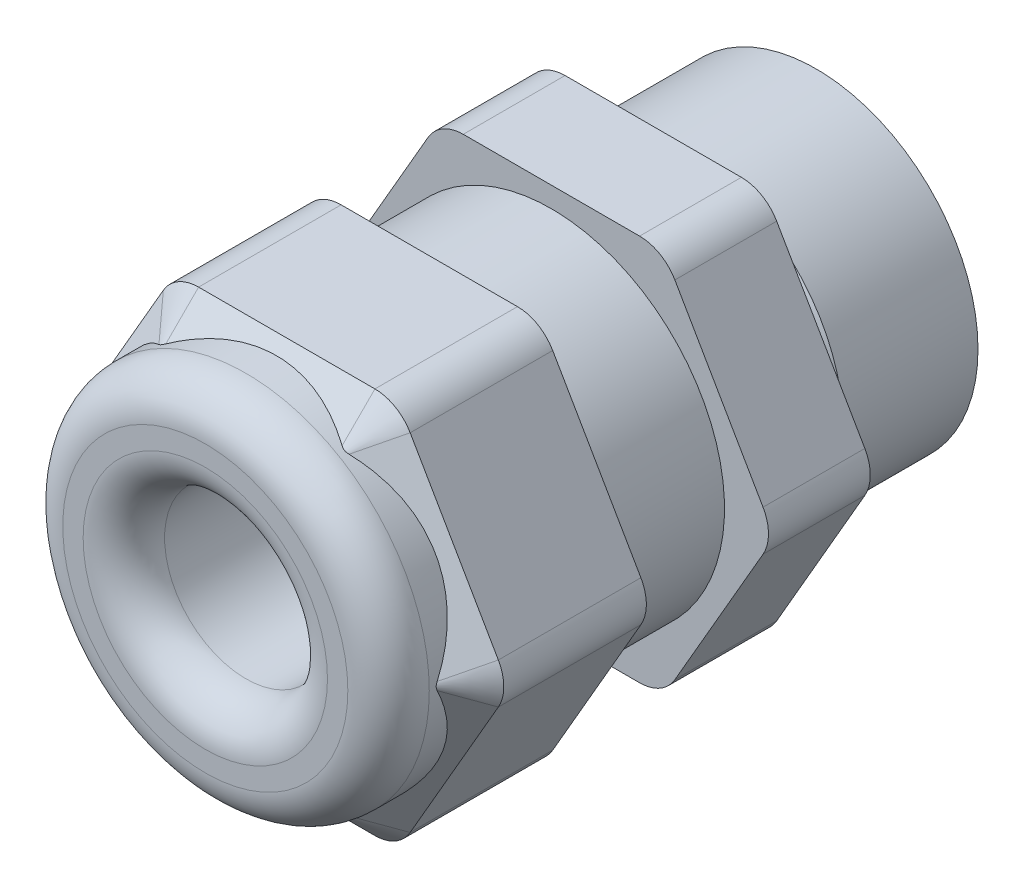
from build123d import *
from OCP.BRepFilletAPI import BRepFilletAPI_MakeChamfer

# Parameters (mm, degrees)
BOSS_EXTRUDE1_DEPTH = 22
SKETCH2_R           = 7.95
BOSS_EXTRUDE2_DEPTH = 8
SKETCH3_OUTSIDE_W   = 32.288
SKETCH3_OUTSIDE_H   = 29.348
SKETCH3_OUTSIDE_R   = 9
CUT_EXTRUDE1_DEPTH  = 2
FILLET1_R           = 2
CHAMFER1_SIZE       = 2
FILLET2_R           = 2
CUT_EXTRUDE2_START  = -5
SKETCH4_OUTSIDE_W   = 31.604
SKETCH4_OUTSIDE_H   = 29.284
SKETCH4_OUTSIDE_R   = 8.5
CUT_EXTRUDE2_DEPTH  = 6
SKETCH5_R           = 4
CUT_EXTRUDE3_DEPTH  = 3
FILLET3_R           = 2
SKETCH6_R           = 5
CUT_EXTRUDE4_DEPTH  = 19
SKETCH7_R           = 0.7
CUT_EXTRUDE5_DEPTH  = 31.543264727
CHAMFER2_SIZE       = 0.5
CHAMFER2_SIZE2      = 0.288675135
SKETCH9_R           = 4
CUT_EXTRUDE6_DEPTH  = 31.543264727


with BuildPart() as part:
    # Sketch1 → Boss-Extrude1 (new body)
    with BuildSketch(Plane.XY):
        Polygon((10.969655115, 0), (5.484827557, 9.5), (-5.484827557, 9.5), (-10.969655115, 0), (-5.484827557, -9.5), (5.484827557, -9.5), align=None)
    extrude(amount=BOSS_EXTRUDE1_DEPTH)

    # Sketch2 → Boss-Extrude2 (add)
    with BuildSketch(Plane(origin=(0, 0, 0), x_dir=(-1, 0, 0), z_dir=(0, 0, -1))):
        Circle(SKETCH2_R)
    extrude(amount=BOSS_EXTRUDE2_DEPTH)

    # Sketch3 outside → Cut-Extrude1 (cut)
    with BuildSketch(Plane.XY.offset(22)):
        Rectangle(SKETCH3_OUTSIDE_W, SKETCH3_OUTSIDE_H)
        Circle(SKETCH3_OUTSIDE_R, mode=Mode.SUBTRACT)
    extrude(amount=-CUT_EXTRUDE1_DEPTH, mode=Mode.SUBTRACT)

    # Fillet1
    fillet1_edges = [part.edges().sort_by_distance(p)[0] for p in [
        (5.484827557, -9.5, 10),
        (-5.484827557, -9.5, 10),
        (-10.969655115, 0, 10),
        (-5.484827557, 9.5, 10),
        (5.484827557, 9.5, 10),
        (10.969655115, 0, 10),
    ]]
    fillet(fillet1_edges, radius=FILLET1_R)

    # Chamfer1
    # the kernel refuses this chamfer: 2 mm, written as the material it takes off along each edge
    with BuildSketch(Plane(origin=(-4.330127019, -9.5, 20), x_dir=(0, 1, 0), z_dir=(1, 0, 0))) as chamfer1_piece_1_section:
        Polygon((CHAMFER1_SIZE, 0), (0, -CHAMFER1_SIZE), (0, 0), align=None)
    chamfer1_piece_1 = extrude(amount=8.660254038, mode=Mode.PRIVATE)
    chamfer1_piece_1 = chamfer1_piece_1 - Plane(origin=(0, 0, 20), x_dir=(1, 0, 0), z_dir=(0, 0, 1)) * Cylinder(9, 26, mode=Mode.PRIVATE)
    add(chamfer1_piece_1, mode=Mode.SUBTRACT)
    with BuildSketch(Plane(origin=(4.330127019, -7.5, 20), x_dir=(0.8660254037844417, -0.49999999999999456, 0), z_dir=(0.49999999999999456, 0.8660254037844417, 0))) as chamfer1_piece_2_section:
        Polygon((2 - CHAMFER1_SIZE, 0), (2, CHAMFER1_SIZE), (2, 0), align=None)
    chamfer1_piece_2 = revolve(axis=Axis((4.330127019, -7.5, 20), (0, 0, -1)), revolution_arc=60, mode=Mode.PRIVATE)
    chamfer1_piece_2 = chamfer1_piece_2 - Plane(origin=(0, 0, 20), x_dir=(1, 0, 0), z_dir=(0, 0, 1)) * Cylinder(9, 8, mode=Mode.PRIVATE)
    add(chamfer1_piece_2, mode=Mode.SUBTRACT)
    with BuildSketch(Plane(origin=(-4.330127019, -7.5, 20), x_dir=(0, -1, 0), z_dir=(1, 0, 0))) as chamfer1_piece_3_section:
        Polygon((2 - CHAMFER1_SIZE, 0), (2, CHAMFER1_SIZE), (2, 0), align=None)
    chamfer1_piece_3 = revolve(axis=Axis((-4.330127019, -7.5, 20), (0, 0, -1)), revolution_arc=60, mode=Mode.PRIVATE)
    chamfer1_piece_3 = chamfer1_piece_3 - Plane(origin=(0, 0, 20), x_dir=(1, 0, 0), z_dir=(0, 0, 1)) * Cylinder(9, 8, mode=Mode.PRIVATE)
    add(chamfer1_piece_3, mode=Mode.SUBTRACT)
    with BuildSketch(Plane(origin=(6.062177826, -8.5, 20), x_dir=(-0.8660254037844416, 0.499999999999995, 0), z_dir=(0.499999999999995, 0.8660254037844416, 0))) as chamfer1_piece_4_section:
        Polygon((CHAMFER1_SIZE, 0), (0, -CHAMFER1_SIZE), (0, 0), align=None)
    chamfer1_piece_4 = extrude(amount=8.660254038, mode=Mode.PRIVATE)
    chamfer1_piece_4 = chamfer1_piece_4 - Plane(origin=(0, 0, 20), x_dir=(1, 0, 0), z_dir=(0, 0, 1)) * Cylinder(9, 26, mode=Mode.PRIVATE)
    add(chamfer1_piece_4, mode=Mode.SUBTRACT)
    with BuildSketch(Plane(origin=(-10.392304845, -1, 20), x_dir=(0.8660254037844345, 0.5000000000000072, 0), z_dir=(0.5000000000000072, -0.8660254037844346, 0))) as chamfer1_piece_5_section:
        Polygon((CHAMFER1_SIZE, 0), (0, -CHAMFER1_SIZE), (0, 0), align=None)
    chamfer1_piece_5 = extrude(amount=8.660254038, mode=Mode.PRIVATE)
    chamfer1_piece_5 = chamfer1_piece_5 - Plane(origin=(0, 0, 20), x_dir=(1, 0, 0), z_dir=(0, 0, 1)) * Cylinder(9, 26, mode=Mode.PRIVATE)
    add(chamfer1_piece_5, mode=Mode.SUBTRACT)
    with BuildSketch(Plane(origin=(8.660254038, 0, 20), x_dir=(0.866025403784438, 0.500000000000001, 0), z_dir=(-0.500000000000001, 0.866025403784438, 0))) as chamfer1_piece_6_section:
        Polygon((2, CHAMFER1_SIZE), (2 - CHAMFER1_SIZE, 0), (2, 0), align=None)
    chamfer1_piece_6 = revolve(axis=Axis((8.660254038, 0, 20), (0, 0, -1)), revolution_arc=60, mode=Mode.PRIVATE)
    chamfer1_piece_6 = chamfer1_piece_6 - Plane(origin=(0, 0, 20), x_dir=(1, 0, 0), z_dir=(0, 0, 1)) * Cylinder(9, 9, mode=Mode.PRIVATE)
    add(chamfer1_piece_6, mode=Mode.SUBTRACT)
    with BuildSketch(Plane(origin=(-8.660254038, 0, 20), x_dir=(-0.8660254037844414, 0.4999999999999952, 0), z_dir=(0.4999999999999952, 0.8660254037844414, 0))) as chamfer1_piece_7_section:
        Polygon((2 - CHAMFER1_SIZE, 0), (2, -CHAMFER1_SIZE), (2, 0), align=None)
    chamfer1_piece_7 = revolve(axis=Axis((-8.660254038, 0, 20), (0, 0, 1)), revolution_arc=60, mode=Mode.PRIVATE)
    chamfer1_piece_7 = chamfer1_piece_7 - Plane(origin=(0, 0, 20), x_dir=(1, 0, 0), z_dir=(0, 0, 1)) * Cylinder(9, 8, mode=Mode.PRIVATE)
    add(chamfer1_piece_7, mode=Mode.SUBTRACT)
    with BuildSketch(Plane(origin=(10.392304845, 1, 20), x_dir=(0, 0, -1), z_dir=(-0.500000000000001, 0.866025403784438, 0))) as chamfer1_piece_8_section:
        Polygon((CHAMFER1_SIZE, 0), (0, CHAMFER1_SIZE), (0, 0), align=None)
    chamfer1_piece_8 = extrude(amount=8.660254038, mode=Mode.PRIVATE)
    chamfer1_piece_8 = chamfer1_piece_8 - Plane(origin=(0, 0, 20), x_dir=(1, 0, 0), z_dir=(0, 0, 1)) * Cylinder(9, 26, mode=Mode.PRIVATE)
    add(chamfer1_piece_8, mode=Mode.SUBTRACT)
    with BuildSketch(Plane(origin=(-6.062177826, 8.5, 20), x_dir=(0.8660254037844415, -0.49999999999999517, 0), z_dir=(-0.49999999999999517, -0.8660254037844415, 0))) as chamfer1_piece_9_section:
        Polygon((CHAMFER1_SIZE, 0), (0, -CHAMFER1_SIZE), (0, 0), align=None)
    chamfer1_piece_9 = extrude(amount=8.660254038, mode=Mode.PRIVATE)
    chamfer1_piece_9 = chamfer1_piece_9 - Plane(origin=(0, 0, 20), x_dir=(1, 0, 0), z_dir=(0, 0, 1)) * Cylinder(9, 26, mode=Mode.PRIVATE)
    add(chamfer1_piece_9, mode=Mode.SUBTRACT)
    with BuildSketch(Plane(origin=(4.330127019, 7.5, 20), x_dir=(0.8660254037844379, 0.5000000000000013, 0), z_dir=(0.5000000000000013, -0.8660254037844379, 0))) as chamfer1_piece_10_section:
        Polygon((2, -CHAMFER1_SIZE), (2 - CHAMFER1_SIZE, 0), (2, 0), align=None)
    chamfer1_piece_10 = revolve(axis=Axis((4.330127019, 7.5, 20), (0, 0, 1)), revolution_arc=60, mode=Mode.PRIVATE)
    chamfer1_piece_10 = chamfer1_piece_10 - Plane(origin=(0, 0, 20), x_dir=(1, 0, 0), z_dir=(0, 0, 1)) * Cylinder(9, 9, mode=Mode.PRIVATE)
    add(chamfer1_piece_10, mode=Mode.SUBTRACT)
    with BuildSketch(Plane(origin=(-4.330127019, 7.5, 20), x_dir=(0, 1, 0), z_dir=(1, 0, 0))) as chamfer1_piece_11_section:
        Polygon((2 - CHAMFER1_SIZE, 0), (2, -CHAMFER1_SIZE), (2, 0), align=None)
    chamfer1_piece_11 = revolve(axis=Axis((-4.330127019, 7.5, 20), (0, 0, 1)), revolution_arc=60, mode=Mode.PRIVATE)
    chamfer1_piece_11 = chamfer1_piece_11 - Plane(origin=(0, 0, 20), x_dir=(1, 0, 0), z_dir=(0, 0, 1)) * Cylinder(9, 8, mode=Mode.PRIVATE)
    add(chamfer1_piece_11, mode=Mode.SUBTRACT)
    with BuildSketch(Plane(origin=(4.330127019, 9.5, 20), x_dir=(0, -1, 0), z_dir=(-1, 0, 0))) as chamfer1_piece_12_section:
        Polygon((CHAMFER1_SIZE, 0), (0, -CHAMFER1_SIZE), (0, 0), align=None)
    chamfer1_piece_12 = extrude(amount=8.660254038, mode=Mode.PRIVATE)
    chamfer1_piece_12 = chamfer1_piece_12 - Plane(origin=(0, 0, 20), x_dir=(1, 0, 0), z_dir=(0, 0, 1)) * Cylinder(9, 26, mode=Mode.PRIVATE)
    add(chamfer1_piece_12, mode=Mode.SUBTRACT)

    # Fillet2
    # the kernel refuses this fillet: 2 mm, written as the material it takes off along each edge
    with BuildSketch(Plane(origin=(0, 0, 22), x_dir=(1, 0, 0), z_dir=(0, -1, 0))) as fillet2_piece_1:
        with BuildLine():
            CenterArc((9 - FILLET2_R, -FILLET2_R), FILLET2_R, 0, 90)
            Line((9 - FILLET2_R, 0), (9, 0))
            Line((9, 0), (9, -FILLET2_R))
        make_face()
    revolve(axis=Axis((0, 0, 22), (0, 0, 1)), mode=Mode.SUBTRACT)

    # Sketch4 outside → Cut-Extrude2 (cut)
    with BuildSketch(Plane(origin=(0, 0, 0), x_dir=(-1, 0, 0), z_dir=(0, 0, -1)).offset(CUT_EXTRUDE2_START)):
        Rectangle(SKETCH4_OUTSIDE_W, SKETCH4_OUTSIDE_H)
        Circle(SKETCH4_OUTSIDE_R, mode=Mode.SUBTRACT)
    extrude(amount=-CUT_EXTRUDE2_DEPTH, mode=Mode.SUBTRACT)

    # Sketch5 → Cut-Extrude3 (cut)
    with BuildSketch(Plane.XY.offset(22)):
        Circle(SKETCH5_R)
    extrude(amount=-CUT_EXTRUDE3_DEPTH, mode=Mode.SUBTRACT)

    # Fillet3
    fillet3_edges = [part.edges().sort_by_distance(p)[0] for p in [
        (-4, 0, 22),
    ]]
    fillet(fillet3_edges, radius=FILLET3_R)

    # Sketch6 → Cut-Extrude4 (cut)
    with BuildSketch(Plane(origin=(0, 0, -8), x_dir=(-1, 0, 0), z_dir=(0, 0, -1))):
        Circle(SKETCH6_R)
    extrude(amount=-CUT_EXTRUDE4_DEPTH, mode=Mode.SUBTRACT)

    # Sketch7 → Cut-Extrude5 (cut, through all)
    with BuildSketch(Plane.XY.offset(19)):
        with Locations((-2.5, 0)):
            Circle(SKETCH7_R)
        with Locations((-1.25, 2.165063509)):
            Circle(SKETCH7_R)
        with Locations((1.25, 2.165063509)):
            Circle(SKETCH7_R)
        with Locations((2.5, 0)):
            Circle(SKETCH7_R)
        with Locations((1.25, -2.165063509)):
            Circle(SKETCH7_R)
        with Locations((-1.25, -2.165063509)):
            Circle(SKETCH7_R)
    extrude(amount=-CUT_EXTRUDE5_DEPTH, mode=Mode.SUBTRACT)

    # Sketch8 → Cut-Revolve1 (revolve, cut)
    with BuildSketch(Plane(origin=(0, 0, 0), x_dir=(1, 0, 0), z_dir=(0, 1, 0)), mode=Mode.PRIVATE) as cut_revolve1_sk:
        with BuildLine():
            Line((-6.75, 0.875), (-7.95, 0.875))
            Line((-7.95, 0.875), (-7.95, -0.625))
            Line((-7.95, -0.625), (-6.75, -0.625))
            ThreePointArc((-6.75, -0.625), (-6, 0.125), (-6.75, 0.875))
        make_face()
    revolve(cut_revolve1_sk.sketch.rotate(Axis((0, 0, 0), (0, 0, -1)), 180), axis=Axis((0, 0, 0), (0, 0, -1)), mode=Mode.SUBTRACT)

    # Chamfer2: one chamfer whose edges measure the first distance from different faces: ONE call of the kernel's chamfer builder (chamfer() names one face for all edges)
    chamfer2_edges_1 = [part.edges().sort_by_distance(p)[0] for p in [
        (-7.95, 0, 0),
    ]]
    chamfer2_side_1 = [part.faces().sort_by_distance(p)[0] for p in [
        (7.979921088, 4.607209589, 0),
    ]]
    chamfer2_edges_2 = [part.edges().sort_by_distance(p)[0] for p in [
        (7.95, 0, -0.875),
    ]]
    chamfer2_side_2 = [part.faces().sort_by_distance(p)[0] for p in [
        (7.95, 0, -4.4375),
    ]]
    chamfer2 = BRepFilletAPI_MakeChamfer(part.part.solid().wrapped)
    for e in chamfer2_edges_1:
        chamfer2.Add(CHAMFER2_SIZE, CHAMFER2_SIZE2, e.wrapped, chamfer2_side_1[0].wrapped)  # the first distance lies on this face
    for e in chamfer2_edges_2:
        chamfer2.Add(CHAMFER2_SIZE, CHAMFER2_SIZE2, e.wrapped, chamfer2_side_2[0].wrapped)  # the first distance lies on this face
    add(Compound.cast(chamfer2.Shape()), mode=Mode.REPLACE)

    # Sketch9 → Cut-Extrude6 (cut, through all)
    with BuildSketch(Plane.XY.offset(19)):
        Circle(SKETCH9_R)
    extrude(amount=-CUT_EXTRUDE6_DEPTH, mode=Mode.SUBTRACT)


solid = part.part
